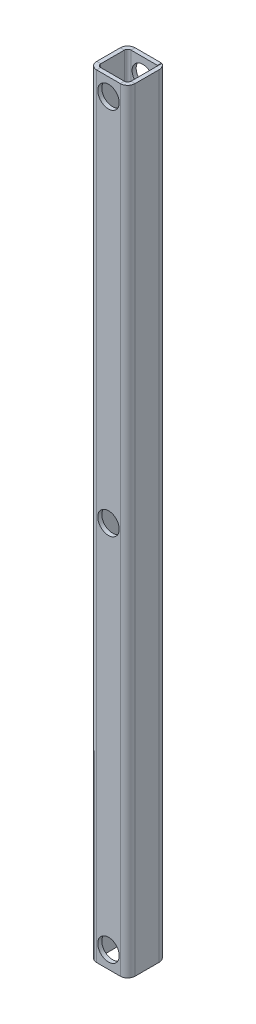
from build123d import *

# Parameters (mm, degrees)
SKETCH12_W                   = 10.16
SKETCH12_H                   = 228.6
BASE_FLANGE1_DEPTH           = 1.2
EDGE_FLANGE1_STRIP_W         = 6.784000096
EDGE_FLANGE1_STRIP_H         = 1.2
EDGE_FLANGE1_STRIP_CUT_DEPTH = 228.6
EDGE_FLANGE1_DEPTH           = 228.6
EDGE_FLANGE2_STRIP_W         = 6.784000096
EDGE_FLANGE2_STRIP_H         = 1.2
EDGE_FLANGE2_STRIP_CUT_DEPTH = 228.6
EDGE_FLANGE2_DEPTH           = 228.6
EDGE_FLANGE3_STRIP_W         = 6.784000096
EDGE_FLANGE3_STRIP_H         = 1.2
EDGE_FLANGE3_STRIP_CUT_DEPTH = 228.6
EDGE_FLANGE3_DEPTH           = 228.6
F_1_4_0_25_DIAMETER_HOLE1_D  = 6.35
CUT_EXTRUDE1_DEPTH           = 116.034681727
CUT_EXTRUDE1_DEPTH_BACK      = 116.034681727
SKETCH30_R                   = 3.175
CLOSED_START                 = -114.3
CLOSED_CORNER1_OUTLINE_W     = 0.127
CLOSED_CORNER1_OUTLINE_H     = 1.2
CLOSED_CORNER1_DEPTH         = 228.6
CLOSED_CORNER1_2_OUTLINE_W   = 1.2
CLOSED_CORNER1_2_OUTLINE_H   = 6.35
CLOSED_CORNER1_2_DEPTH       = 228.6
FILLET1_R                    = 2.54


# Read off the part's stored shape, not the designer's step: Closed Corner1
# Sheet-metal steps are written as plain solids
with BuildPart() as part:
    # Sketch12 → Base-Flange1 (new body)
    with BuildSketch(Plane.XY):
        Rectangle(SKETCH12_W, SKETCH12_H)
    extrude(amount=-BASE_FLANGE1_DEPTH)

    # Edge-Flange1 strip (across the edge) → Edge-Flange1 strip cut (cut)
    with BuildSketch(Plane(origin=(-5.08, 114.3, 0), x_dir=(1, 0, 0), z_dir=(0, -1, 0))):
        with Locations((-1.2, -0.6)):
            Rectangle(EDGE_FLANGE1_STRIP_W, EDGE_FLANGE1_STRIP_H)
    extrude(amount=EDGE_FLANGE1_STRIP_CUT_DEPTH, mode=Mode.SUBTRACT)

    # Edge-Flange1 section (across the edge) → Edge-Flange1 (add)
    with BuildSketch(Plane(origin=(-5.08, 114.3, 0), x_dir=(1, 0, 0), z_dir=(0, -1, 0))):
        with BuildLine():
            Line((0, 0.992000048), (0, 10.16))
            Line((0, 10.16), (1.2, 10.16))
            Line((1.2, 10.16), (1.2, 0.992000048))
            ThreePointArc((1.2, 0.992000048), (1.490550087, 0.290550087), (2.192000048, 0))
            Line((2.192000048, 0), (2.192000048, -1.2))
            ThreePointArc((2.192000048, -1.2), (0.64202195, -0.55797805), (0, 0.992000048))
        make_face()
    extrude(amount=EDGE_FLANGE1_DEPTH)

    # Edge-Flange2 strip (across the edge) → Edge-Flange2 strip cut (cut)
    with BuildSketch(Plane(origin=(-3.88, 114.3, 10.16), x_dir=(0, 0, -1), z_dir=(0, -1, 0))):
        with Locations((-1.2, -0.6)):
            Rectangle(EDGE_FLANGE2_STRIP_W, EDGE_FLANGE2_STRIP_H)
    extrude(amount=EDGE_FLANGE2_STRIP_CUT_DEPTH, mode=Mode.SUBTRACT)

    # Edge-Flange2 section (across the edge) → Edge-Flange2 (add)
    with BuildSketch(Plane(origin=(-3.88, 114.3, 10.16), x_dir=(0, 0, -1), z_dir=(0, -1, 0))):
        with BuildLine():
            Line((0, 0.992000048), (0, 8.96))
            Line((0, 8.96), (1.2, 8.96))
            Line((1.2, 8.96), (1.2, 0.992000048))
            ThreePointArc((1.2, 0.992000048), (1.490550087, 0.290550087), (2.192000048, 0))
            Line((2.192000048, 0), (2.192000048, -1.2))
            ThreePointArc((2.192000048, -1.2), (0.64202195, -0.55797805), (0, 0.992000048))
        make_face()
    extrude(amount=EDGE_FLANGE2_DEPTH)

    # Edge-Flange3 strip (across the edge) → Edge-Flange3 strip cut (cut)
    with BuildSketch(Plane(origin=(5.08, 114.3, 8.96), x_dir=(-1, 0, 0), z_dir=(0, -1, 0))):
        with Locations((-2.4, -0.6)):
            Rectangle(EDGE_FLANGE3_STRIP_W, EDGE_FLANGE3_STRIP_H)
    extrude(amount=EDGE_FLANGE3_STRIP_CUT_DEPTH, mode=Mode.SUBTRACT)

    # Edge-Flange3 section (across the edge) → Edge-Flange3 (add)
    with BuildSketch(Plane(origin=(5.08, 114.3, 8.96), x_dir=(-1, 0, 0), z_dir=(0, -1, 0))):
        with BuildLine():
            Line((-1.2, 0.992000048), (-1.2, 3.81))
            Line((-1.2, 3.81), (0, 3.81))
            Line((0, 3.81), (0, 0.992000048))
            ThreePointArc((0, 0.992000048), (0.290550087, 0.290550087), (0.992000048, 0))
            Line((0.992000048, 0), (0.992000048, -1.2))
            ThreePointArc((0.992000048, -1.2), (-0.55797805, -0.55797805), (-1.2, 0.992000048))
        make_face()
    extrude(amount=EDGE_FLANGE3_DEPTH)

    # 1/4 (0.25) Diameter Hole1 (through all)
    with Locations(Plane.XY.offset(10.16)):
        with Locations((0.6, 0)):
            Hole(F_1_4_0_25_DIAMETER_HOLE1_D / 2)

    # Sketch30 → Cut-Extrude1 (cut, two sides: drawn at the far end of the back side and taken through both)
    with BuildSketch(Plane.XY.offset(10.16).offset(-CUT_EXTRUDE1_DEPTH_BACK)):
        with Locations((0.6, -109.22)):
            Circle(SKETCH30_R)
        with Locations((0.6, 109.22)):
            Circle(SKETCH30_R)
    extrude(amount=CUT_EXTRUDE1_DEPTH + CUT_EXTRUDE1_DEPTH_BACK, mode=Mode.SUBTRACT)

    # Closed Corner1 outline → Closed Corner1 (cut)
    with BuildSketch(Plane(origin=(0, 0, 0), x_dir=(1, 0, 0), z_dir=(0, 1, 0)).offset(CLOSED_START)):
        with Locations((5.0165, 0.6)):
            Rectangle(CLOSED_CORNER1_OUTLINE_W, CLOSED_CORNER1_OUTLINE_H)
    extrude(amount=CLOSED_CORNER1_DEPTH, mode=Mode.SUBTRACT)

    # Closed Corner1 2 outline → Closed Corner1 2 (add)
    with BuildSketch(Plane(origin=(0, 0, 0), x_dir=(1, 0, 0), z_dir=(0, 1, 0)).offset(CLOSED_START)):
        with Locations((5.68, -1.975)):
            Rectangle(CLOSED_CORNER1_2_OUTLINE_W, CLOSED_CORNER1_2_OUTLINE_H)
    extrude(amount=CLOSED_CORNER1_2_DEPTH)

    # Fillet1
    # the kernel refuses this fillet: 2.54 mm, written as the material it takes off along each edge
    with BuildSketch(Plane(origin=(6.28, -119.694441584, -1.2), x_dir=(0, 0, 1), z_dir=(0, 1, 0))) as fillet1_piece_1:
        with BuildLine():
            CenterArc((2.157776633, -2.54), FILLET1_R, 90, 58.159322109)
            Line((0, -1.2), (-0.043155533, -1.1732))
            ThreePointArc((-0.043155533, -1.1732), (-0.0508, -0.6), (-0.0508, 0))
            Line((-0.0508, 0), (0, 0.0508))
            Line((0, 0.0508), (2.157776633, 0.0508))
            Line((2.157776633, 0.0508), (2.157776633, 0))
        make_face()
    extrude(amount=239.388883167, mode=Mode.SUBTRACT)


solid = part.part
